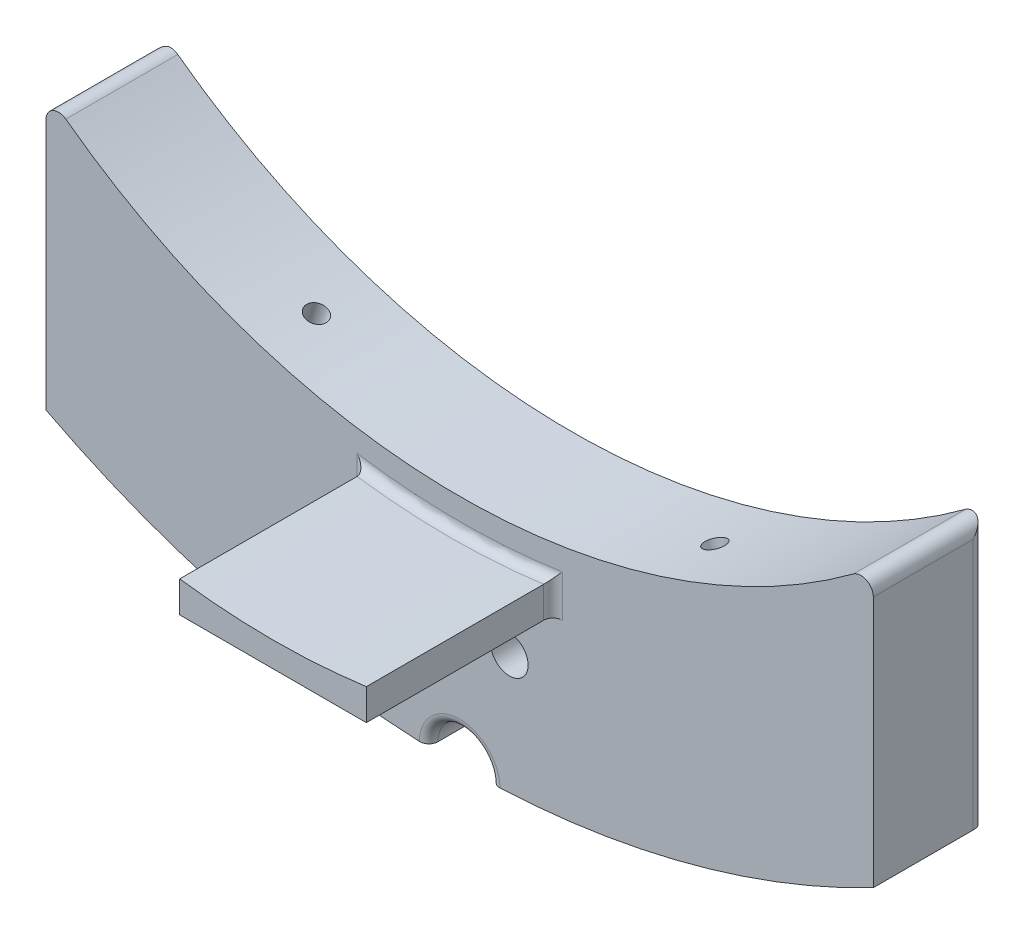
from build123d import *

# Parameters (mm, degrees)
BOSS_EXTRUDE1_DEPTH                   = 9
BOSS_EXTRUDE1_DEPTH_BACK              = 9
TAP_DRILL_FOR_M4_TAP1_D               = 3.3
TAP_DRILL_FOR_M4_TAP1_DEPTH           = 25
TAP_DRILL_FOR_M4_TAP1_TIP             = 0.991420021
TAP_DRILL_FOR_M4_TAP1_ON_FACE_2_D     = 3.3
TAP_DRILL_FOR_M4_TAP1_ON_FACE_2_DEPTH = 25
TAP_DRILL_FOR_M4_TAP1_ON_FACE_2_TIP   = 0.991420021
TAP_DRILL_FOR_M4_TAP1_ON_FACE_3_D     = 3.3
TAP_DRILL_FOR_M4_TAP1_ON_FACE_3_DEPTH = 25
TAP_DRILL_FOR_M4_TAP1_ON_FACE_3_TIP   = 0.991420021
TAP_DRILL_FOR_M4_TAP1_ON_FACE_4_D     = 3.3
TAP_DRILL_FOR_M4_TAP1_ON_FACE_4_DEPTH = 25
TAP_DRILL_FOR_M4_TAP1_ON_FACE_4_TIP   = 0.991420021
TAP_DRILL_FOR_M4_TAP1_ON_FACE_5_D     = 3.3
TAP_DRILL_FOR_M4_TAP1_ON_FACE_5_DEPTH = 25
TAP_DRILL_FOR_M4_TAP1_ON_FACE_5_TIP   = 0.991420021
TAP_DRILL_FOR_M4_TAP1_ON_FACE_6_D     = 3.3
TAP_DRILL_FOR_M4_TAP1_ON_FACE_6_DEPTH = 25
TAP_DRILL_FOR_M4_TAP1_ON_FACE_6_TIP   = 0.991420021
FILLET2_R                             = 2
CUT_EXTRUDE2_DEPTH                    = 159.865224489
CUT_EXTRUDE2_DEPTH_BACK               = 159.865224489
SKETCH3_R                             = 5
FILLET3_R                             = 1.5
BOSS_EXTRUDE2_START                   = 9
BOSS_EXTRUDE2_DEPTH                   = 30
FILLET4_R                             = 1.5
FILLET5_R                             = 2
CUT_EXTRUDE3_DEPTH                    = 164.257977095
CUT_EXTRUDE3_DEPTH_BACK               = 164.257977095
SKETCH4_3_R                           = 3
FILLET6_R                             = 1.5
WRAP1_START                           = -0.5
WRAP1_DEPTH                           = 0.5


# Read off the part's stored shape, not the designer's step: Wrap1
with BuildPart() as part:
    # Sketch1 → Boss-Extrude1 (new, two sides: drawn at the far end of the back side and taken through both)
    with BuildSketch(Plane.XY.offset(-BOSS_EXTRUDE1_DEPTH_BACK)):
        with BuildLine():
            Line((66.491800306, -127.729559978), (66.491800306, -83.193091613))
            ThreePointArc((66.491800306, -83.193091613), (0, -106.5), (-66.491800306, -83.193091613))
            Line((-66.491800306, -83.193091613), (-66.491800306, -127.729559978))
            ThreePointArc((-66.491800306, -127.729559978), (0, -144), (66.491800306, -127.729559978))
        make_face()
    extrude(amount=BOSS_EXTRUDE1_DEPTH + BOSS_EXTRUDE1_DEPTH_BACK)

    # Tap Drill for M4 Tap1
    with Locations(Plane(origin=(-32.025167647, -101.570855255, 0), x_dir=(0.953716950748, -0.300705799504, 0), z_dir=(0.300705799504, 0.953716950748, 0))):
        with Locations((0, 0)):
            Hole(TAP_DRILL_FOR_M4_TAP1_D / 2, depth=TAP_DRILL_FOR_M4_TAP1_DEPTH)
            with Locations((0, 0, -(TAP_DRILL_FOR_M4_TAP1_DEPTH + TAP_DRILL_FOR_M4_TAP1_TIP / 2))):  # 118° drill point
                Cone(0, TAP_DRILL_FOR_M4_TAP1_D / 2, TAP_DRILL_FOR_M4_TAP1_TIP, mode=Mode.SUBTRACT)

    # Tap Drill for M4 Tap1 on face 2
    with Locations(Plane(origin=(32.025167647, -101.570855255, 0), x_dir=(0.953716897702, 0.300705967746, 0), z_dir=(-0.300705967746, 0.953716897702, 0))):
        with Locations((0, 0)):
            Hole(TAP_DRILL_FOR_M4_TAP1_ON_FACE_2_D / 2, depth=TAP_DRILL_FOR_M4_TAP1_ON_FACE_2_DEPTH)
            with Locations((0, 0, -(TAP_DRILL_FOR_M4_TAP1_ON_FACE_2_DEPTH + TAP_DRILL_FOR_M4_TAP1_ON_FACE_2_TIP / 2))):  # 118° drill point
                Cone(0, TAP_DRILL_FOR_M4_TAP1_ON_FACE_2_D / 2, TAP_DRILL_FOR_M4_TAP1_ON_FACE_2_TIP, mode=Mode.SUBTRACT)

    # Tap Drill for M4 Tap1 on face 3
    with Locations(Plane(origin=(-55.106414261, -133.038652682, 0), x_dir=(-0.923879753837, 0.382682898036, 0), z_dir=(-0.382682898036, -0.923879753837, 0))):
        with Locations((0, 0)):
            Hole(TAP_DRILL_FOR_M4_TAP1_ON_FACE_3_D / 2, depth=TAP_DRILL_FOR_M4_TAP1_ON_FACE_3_DEPTH)
            with Locations((0, 0, -(TAP_DRILL_FOR_M4_TAP1_ON_FACE_3_DEPTH + TAP_DRILL_FOR_M4_TAP1_ON_FACE_3_TIP / 2))):  # 118° drill point
                Cone(0, TAP_DRILL_FOR_M4_TAP1_ON_FACE_3_D / 2, TAP_DRILL_FOR_M4_TAP1_ON_FACE_3_TIP, mode=Mode.SUBTRACT)

    # Tap Drill for M4 Tap1 on face 4
    with Locations(Plane(origin=(18.79577168, -142.768060038, 0), x_dir=(-0.991444888611, -0.130525985335, 0), z_dir=(0.130525985335, -0.991444888611, 0))):
        with Locations((0, 0)):
            Hole(TAP_DRILL_FOR_M4_TAP1_ON_FACE_4_D / 2, depth=TAP_DRILL_FOR_M4_TAP1_ON_FACE_4_DEPTH)
            with Locations((0, 0, -(TAP_DRILL_FOR_M4_TAP1_ON_FACE_4_DEPTH + TAP_DRILL_FOR_M4_TAP1_ON_FACE_4_TIP / 2))):  # 118° drill point
                Cone(0, TAP_DRILL_FOR_M4_TAP1_ON_FACE_4_D / 2, TAP_DRILL_FOR_M4_TAP1_ON_FACE_4_TIP, mode=Mode.SUBTRACT)

    # Tap Drill for M4 Tap1 on face 5
    with Locations(Plane(origin=(55.106414261, -133.038652682, 0), x_dir=(-0.923879753837, -0.382682898036, 0), z_dir=(0.382682898036, -0.923879753837, 0))):
        with Locations((0, 0)):
            Hole(TAP_DRILL_FOR_M4_TAP1_ON_FACE_5_D / 2, depth=TAP_DRILL_FOR_M4_TAP1_ON_FACE_5_DEPTH)
            with Locations((0, 0, -(TAP_DRILL_FOR_M4_TAP1_ON_FACE_5_DEPTH + TAP_DRILL_FOR_M4_TAP1_ON_FACE_5_TIP / 2))):  # 118° drill point
                Cone(0, TAP_DRILL_FOR_M4_TAP1_ON_FACE_5_D / 2, TAP_DRILL_FOR_M4_TAP1_ON_FACE_5_TIP, mode=Mode.SUBTRACT)

    # Tap Drill for M4 Tap1 on face 6
    with Locations(Plane(origin=(-18.79577168, -142.768060038, 0), x_dir=(-0.991444888611, 0.130525985335, 0), z_dir=(-0.130525985335, -0.991444888611, 0))):
        with Locations((0, 0)):
            Hole(TAP_DRILL_FOR_M4_TAP1_ON_FACE_6_D / 2, depth=TAP_DRILL_FOR_M4_TAP1_ON_FACE_6_DEPTH)
            with Locations((0, 0, -(TAP_DRILL_FOR_M4_TAP1_ON_FACE_6_DEPTH + TAP_DRILL_FOR_M4_TAP1_ON_FACE_6_TIP / 2))):  # 118° drill point
                Cone(0, TAP_DRILL_FOR_M4_TAP1_ON_FACE_6_D / 2, TAP_DRILL_FOR_M4_TAP1_ON_FACE_6_TIP, mode=Mode.SUBTRACT)

    # Fillet2
    fillet2_edges = [part.edges().sort_by_distance(p)[0] for p in [
        (66.491800306, -83.193091613, 0),
        (-66.491800306, -83.193091613, 0),
    ]]
    fillet(fillet2_edges, radius=FILLET2_R)

    # Sketch3 → Cut-Extrude2 (cut, two sides: drawn at the far end of the back side and taken through both)
    with BuildSketch(Plane.XY.offset(-CUT_EXTRUDE2_DEPTH_BACK)):
        with Locations((0, -144)):
            Circle(SKETCH3_R)
    extrude(amount=CUT_EXTRUDE2_DEPTH + CUT_EXTRUDE2_DEPTH_BACK, mode=Mode.SUBTRACT)

    # Fillet3
    fillet3_edges = [part.edges().sort_by_distance(p)[0] for p in [
        (0, -139, -9),
        (0, -139, 9),
    ]]
    fillet(fillet3_edges, radius=FILLET3_R)

    # Sketch4 → Boss-Extrude2 (add)
    with BuildSketch(Plane.XY.offset(BOSS_EXTRUDE2_START)):
        with BuildLine():
            Line((0, -115.5), (0, -111.5))
            ThreePointArc((0, -111.5), (-7.517102754, -111.24631754), (-15, -110.486424505))
            Line((-15, -110.486424505), (-15, -115.5))
            Line((-15, -115.5), (0, -115.5))
        make_face()
        with BuildLine():
            ThreePointArc((15, -110.486424505), (7.517102754, -111.24631754), (0, -111.5))
            Line((0, -111.5), (0, -115.5))
            Line((0, -115.5), (15, -115.5))
            Line((15, -115.5), (15, -110.486424505))
        make_face()
    extrude(amount=BOSS_EXTRUDE2_DEPTH)

    # Fillet4
    fillet4_edges = [part.edges().sort_by_distance(p)[0] for p in [
        (-15, -112.993212253, 9),
        (0, -111.5, 9),
        (15, -112.993212253, 9),
    ]]
    fillet(fillet4_edges, radius=FILLET4_R)

    # Fillet5
    # the kernel refuses this fillet: 2 mm, written as the material it takes off along each edge
    with BuildSketch(Plane(origin=(66.491800306, -132.729559978, -9), x_dir=(-1, 0, 0), z_dir=(0, 1, 0)), Plane(origin=(-66.491800306, -82.252837738, -9), x_dir=(1, 0, 0), z_dir=(0, -1, 0))) as fillet5_piece_1:
        with BuildLine():
            CenterArc((FILLET5_R, FILLET5_R), FILLET5_R, 180, 90)
            Line((0, FILLET5_R), (0, 0))
            Line((0, 0), (FILLET5_R, 0))
        make_face()
    extrude(amount=50.47672224, mode=Mode.SUBTRACT)

    # Sketch4<3> → Cut-Extrude3 (cut, two sides: drawn at the far end of the back side and taken through both)
    with BuildSketch(Plane.XY.offset(-CUT_EXTRUDE3_DEPTH_BACK)):
        with Locations((-8, -124.5)):
            Circle(SKETCH4_3_R)
        with Locations((8, -124.5)):
            Circle(SKETCH4_3_R)
    extrude(amount=CUT_EXTRUDE3_DEPTH + CUT_EXTRUDE3_DEPTH_BACK, mode=Mode.SUBTRACT)

    # Fillet6
    fillet6_edges = [part.edges().sort_by_distance(p)[0] for p in [
        (-11, -124.5, -9),
        (5, -124.5, -9),
    ]]
    fillet(fillet6_edges, radius=FILLET6_R)

    # Wrap1 outline → Wrap1 (cut)
    with BuildSketch(Plane(origin=(0, 0, -9), x_dir=(-1, 0, 0), z_dir=(0, 0, -1)).offset(WRAP1_START)):
        Polygon((-5.892307692, -130.820512821), (-5.892307692, -130), (-10.097435897, -130), (-10.097435897, -130.820512821), (-8.353846154, -130.820512821), (-8.353846154, -138), (-7.635897436, -138), (-7.635897436, -130.820512821), align=None)
        Polygon((7.976923077, -136.564102564), (4.674038462, -130), (4.571474359, -130), (3.515384615, -138), (4.238141026, -138), (5.002564103, -132.230769231), (7.901602564, -138), (8.063461538, -138), (10.951282051, -132.243589744), (11.717307692, -138), (12.438461538, -138), (11.375961538, -130), (11.271794872, -130), align=None)
    extrude(amount=WRAP1_DEPTH, mode=Mode.SUBTRACT)


solid = part.part
